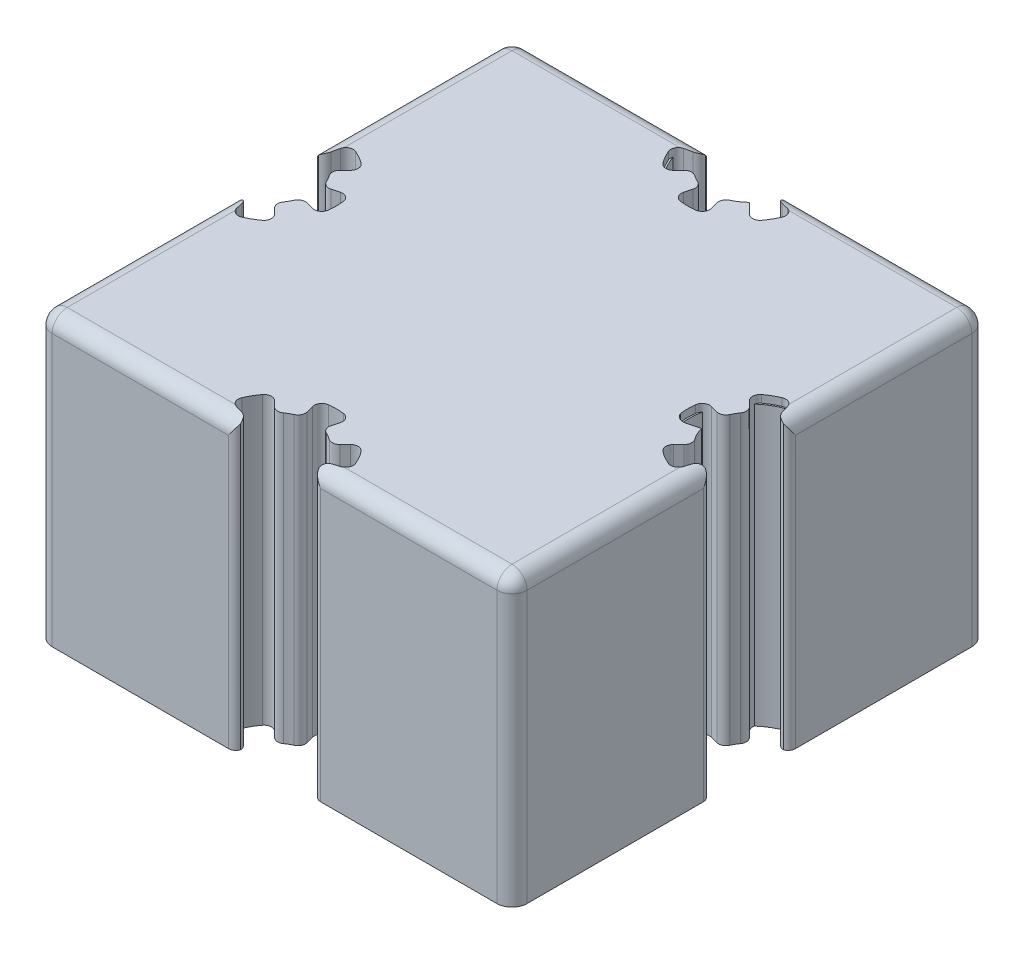
from build123d import *
from build123d.topology import SkipClean

# Parameters (mm, degrees)
SKETCH2_W            = 31.5
SKETCH2_H            = 31.5
BOSS_EXTRUDE1_DEPTH  = 19
CUT_EXTRUDE6_DEPTH   = 30.276697218
FILLET12_R           = 0.5
BOSS_EXTRUDE9_START  = -0.5
BOSS_EXTRUDE9_DEPTH  = 18.5
BOSS_EXTRUDE10_DEPTH = 19
CUT_EXTRUDE10_DEPTH  = 30.276697218
SKETCH15_W           = 0.6
SKETCH15_H           = 1.65
CUT_EXTRUDE13_DEPTH  = 1.5
CUT_EXTRUDE14_DEPTH  = 1.5
CUT_EXTRUDE15_START  = -17
CUT_EXTRUDE15_DEPTH  = 17
FILLET22_R           = 0.5
FILLET24_R           = 0.2
FILLET27_R           = 1
FILLET28_R           = 0.5


# Read off the part's stored shape, not the designer's step: Cut-Extrude15
with BuildPart() as part:
    # Sketch2 → Boss-Extrude1 (new body)
    with BuildSketch(Plane(origin=(0, 0, 0), x_dir=(1, 0, 0), z_dir=(0, 1, 0))):
        Rectangle(SKETCH2_W, SKETCH2_H)
    extrude(amount=BOSS_EXTRUDE1_DEPTH)

    # Sketch5 → Cut-Extrude6 (cut, through all)
    with BuildSketch(Plane(origin=(0, 19, 0), x_dir=(1, 0, 0), z_dir=(0, 1, 0))):
        with BuildLine():
            Line((-2.899137803, 12.850862197), (-1.838477631, 13.911522369))
            ThreePointArc((-1.838477631, 13.911522369), (-2.25166605, 14.45), (-2.511407148, 15.077070483))
            Line((-2.511407148, 15.077070483), (-3.960295888, 14.688841915))
            ThreePointArc((-3.960295888, 14.688841915), (-3.550704156, 13.7), (-2.899137803, 12.850862197))
        make_face()
        with BuildLine():
            Line((1.061158085, 11.789704112), (0.672929517, 13.238592852))
            ThreePointArc((0.672929517, 13.238592852), (0, 13.15), (-0.672929517, 13.238592852))
            Line((-0.672929517, 13.238592852), (-1.061158085, 11.789704112))
            ThreePointArc((-1.061158085, 11.789704112), (0, 11.65), (1.061158085, 11.789704112))
        make_face()
        with BuildLine():
            ThreePointArc((2.511407148, 15.077070483), (2.25166605, 14.45), (1.838477631, 13.911522369))
            Line((1.838477631, 13.911522369), (2.899137803, 12.850862197))
            ThreePointArc((2.899137803, 12.850862197), (3.550704156, 13.7), (3.960295888, 14.688841915))
            Line((3.960295888, 14.688841915), (2.511407148, 15.077070483))
        make_face()
        with BuildLine():
            ThreePointArc((-0.672929517, 13.238592852), (0, 13.15), (0.672929517, 13.238592852))
            ThreePointArc((0.672929517, 13.238592852), (1.3, 13.49833395), (1.838477631, 13.911522369))
            ThreePointArc((1.838477631, 13.911522369), (2.25166605, 14.45), (2.511407148, 15.077070483))
            ThreePointArc((2.511407148, 15.077070483), (2.57775664, 15.4106319), (2.6, 15.75))
            Line((2.6, 15.75), (0, 15.75))
            Line((0, 15.75), (-2.6, 15.75))
            ThreePointArc((-2.6, 15.75), (-2.57775664, 15.4106319), (-2.511407148, 15.077070483))
            ThreePointArc((-2.511407148, 15.077070483), (-2.25166605, 14.45), (-1.838477631, 13.911522369))
            ThreePointArc((-1.838477631, 13.911522369), (-1.3, 13.49833395), (-0.672929517, 13.238592852))
        make_face()
        with BuildLine():
            Line((15.75, -2.6), (15.75, 0))
            Line((15.75, 0), (15.75, 2.6))
            ThreePointArc((15.75, 2.6), (15.4106319, 2.57775664), (15.077070483, 2.511407148))
            ThreePointArc((15.077070483, 2.511407148), (14.45, 2.25166605), (13.911522369, 1.838477631))
            ThreePointArc((13.911522369, 1.838477631), (13.49833395, 1.3), (13.238592852, 0.672929517))
            ThreePointArc((13.238592852, 0.672929517), (13.15, 0), (13.238592852, -0.672929517))
            ThreePointArc((13.238592852, -0.672929517), (13.49833395, -1.3), (13.911522369, -1.838477631))
            ThreePointArc((13.911522369, -1.838477631), (14.45, -2.25166605), (15.077070483, -2.511407148))
            ThreePointArc((15.077070483, -2.511407148), (15.4106319, -2.57775664), (15.75, -2.6))
        make_face()
        with BuildLine():
            ThreePointArc((13.911522369, 1.838477631), (14.45, 2.25166605), (15.077070483, 2.511407148))
            Line((15.077070483, 2.511407148), (14.688841915, 3.960295888))
            ThreePointArc((14.688841915, 3.960295888), (13.7, 3.550704156), (12.850862197, 2.899137803))
            Line((12.850862197, 2.899137803), (13.911522369, 1.838477631))
        make_face()
        with BuildLine():
            Line((11.789704112, -1.061158085), (13.238592852, -0.672929517))
            ThreePointArc((13.238592852, -0.672929517), (13.15, 0), (13.238592852, 0.672929517))
            Line((13.238592852, 0.672929517), (11.789704112, 1.061158085))
            ThreePointArc((11.789704112, 1.061158085), (11.65, 0), (11.789704112, -1.061158085))
        make_face()
        with BuildLine():
            Line((14.688841915, -3.960295888), (15.077070483, -2.511407148))
            ThreePointArc((15.077070483, -2.511407148), (14.45, -2.25166605), (13.911522369, -1.838477631))
            Line((13.911522369, -1.838477631), (12.850862197, -2.899137803))
            ThreePointArc((12.850862197, -2.899137803), (13.7, -3.550704156), (14.688841915, -3.960295888))
        make_face()
    extrude(amount=-CUT_EXTRUDE6_DEPTH, mode=Mode.SUBTRACT)

    # Fillet12
    fillet12_edges = [part.edges().sort_by_distance(p)[0] for p in [
        (-2.899137803, 9.5, -12.850862197),
        (-3.960295888, 9.5, -14.688841915),
        (3.960295888, 9.5, -14.688841915),
        (2.899137803, 9.5, -12.850862197),
        (1.061158085, 9.5, -11.789704112),
        (-1.061158085, 9.5, -11.789704112),
        (14.688841915, 9.5, 3.960295888),
        (12.850862197, 9.5, 2.899137803),
        (11.789704112, 9.5, 1.061158085),
        (11.789704112, 9.5, -1.061158085),
        (12.850862197, 9.5, -2.899137803),
        (14.688841915, 9.5, -3.960295888),
    ]]
    fillet(fillet12_edges, radius=FILLET12_R)

    # Sketch10 → Boss-Extrude9 (add, through all)
    with BuildSketch(Plane(origin=(0, 19, 0), x_dir=(1, 0, 0), z_dir=(0, 1, 0)).offset(BOSS_EXTRUDE9_START)):
        with BuildLine():
            Line((15.75, 4.4), (15.75, 4))
            ThreePointArc((15.75, 4), (11.75, 0), (15.75, -4))
            Line((15.75, -4), (15.75, -4.4))
            ThreePointArc((15.75, -4.4), (11.35, 0), (15.75, 4.4))
        make_face()
        with BuildLine():
            Line((-4.4, 15.75), (-4, 15.75))
            ThreePointArc((-4, 15.75), (0, 11.75), (4, 15.75))
            Line((4, 15.75), (4.4, 15.75))
            ThreePointArc((4.4, 15.75), (0, 11.35), (-4.4, 15.75))
        make_face()
    extrude(amount=-BOSS_EXTRUDE9_DEPTH)

    # Sketch11 → Boss-Extrude10 (add, through all)
    with BuildSketch(Plane(origin=(0, 19, 0), x_dir=(1, 0, 0), z_dir=(0, 1, 0))):
        with BuildLine():
            Line((12.306369439, -0.922718028), (13.238592852, -0.672929517))
            Line((13.238592852, -0.672929517), (12.399440494, -0.88753005))
            ThreePointArc((12.399440494, -0.88753005), (11.964637448, -0.834388388), (11.680704349, -0.500832214))
            ThreePointArc((11.680704349, -0.500832214), (11.897422951, -0.854314019), (12.306369439, -0.922718028))
        make_face()
    extrude(amount=-BOSS_EXTRUDE10_DEPTH)

    # Sketch6 → Cut-Extrude10 (cut, through all)
    with BuildSketch(Plane(origin=(0, 19, 0), x_dir=(1, 0, 0), z_dir=(0, 1, 0))):
        with BuildLine():
            Line((-2.6, -15.75), (2.6, -15.75))
            ThreePointArc((2.6, -15.75), (2.57775664, -15.4106319), (2.511407148, -15.077070483))
            Line((2.511407148, -15.077070483), (3.960295888, -14.688841915))
            ThreePointArc((3.960295888, -14.688841915), (3.550704156, -13.7), (2.899137803, -12.850862197))
            Line((2.899137803, -12.850862197), (1.838477631, -13.911522369))
            ThreePointArc((1.838477631, -13.911522369), (1.3, -13.49833395), (0.672929517, -13.238592852))
            Line((0.672929517, -13.238592852), (1.061158085, -11.789704112))
            ThreePointArc((1.061158085, -11.789704112), (0, -11.65), (-1.061158085, -11.789704112))
            Line((-1.061158085, -11.789704112), (-0.672929517, -13.238592852))
            ThreePointArc((-0.672929517, -13.238592852), (-1.3, -13.49833395), (-1.838477631, -13.911522369))
            Line((-1.838477631, -13.911522369), (-2.899137803, -12.850862197))
            ThreePointArc((-2.899137803, -12.850862197), (-3.550704156, -13.7), (-3.960295888, -14.688841915))
            Line((-3.960295888, -14.688841915), (-2.511407148, -15.077070483))
            ThreePointArc((-2.511407148, -15.077070483), (-2.57775664, -15.4106319), (-2.6, -15.75))
        make_face()
        with BuildLine():
            Line((-15.75, 2.6), (-15.75, -2.6))
            ThreePointArc((-15.75, -2.6), (-15.4106319, -2.57775664), (-15.077070483, -2.511407148))
            Line((-15.077070483, -2.511407148), (-14.688841915, -3.960295888))
            ThreePointArc((-14.688841915, -3.960295888), (-13.7, -3.550704156), (-12.850862197, -2.899137803))
            Line((-12.850862197, -2.899137803), (-13.911522369, -1.838477631))
            ThreePointArc((-13.911522369, -1.838477631), (-13.49833395, -1.3), (-13.238592852, -0.672929517))
            Line((-13.238592852, -0.672929517), (-11.789704112, -1.061158085))
            ThreePointArc((-11.789704112, -1.061158085), (-11.65, 0), (-11.789704112, 1.061158085))
            Line((-11.789704112, 1.061158085), (-13.238592852, 0.672929517))
            ThreePointArc((-13.238592852, 0.672929517), (-13.49833395, 1.3), (-13.911522369, 1.838477631))
            Line((-13.911522369, 1.838477631), (-12.850862197, 2.899137803))
            ThreePointArc((-12.850862197, 2.899137803), (-13.7, 3.550704156), (-14.688841915, 3.960295888))
            Line((-14.688841915, 3.960295888), (-15.077070483, 2.511407148))
            ThreePointArc((-15.077070483, 2.511407148), (-15.4106319, 2.57775664), (-15.75, 2.6))
        make_face()
    extrude(amount=-CUT_EXTRUDE10_DEPTH, mode=Mode.SUBTRACT)

    # Sketch15 → Cut-Extrude13 (cut)
    with BuildSketch(Plane.XZ):
        with Locations((7.476057473, -13.220362663)):
            Rectangle(SKETCH15_W, SKETCH15_H)
        with BuildLine():
            Line((-0.472700067, 4.977605312), (-0.549642862, 10.981573349))
            ThreePointArc((-0.549642862, 10.981573349), (-2.947700228, 11.961720263), (-4.487116173, 14.045362663))
            Line((-4.487116173, 14.045362663), (-7.176057473, 14.045362663))
            Line((-7.176057473, 14.045362663), (-7.176057473, 12.395362663))
            Line((-7.176057473, 12.395362663), (-7.776057473, 12.395362663))
            Line((-7.776057473, 12.395362663), (-7.776057473, 14.045362663))
            Line((-7.776057473, 14.045362663), (-14.35, 14.045362663))
            Line((-14.35, 14.045362663), (-14.35, 7.35))
            Line((-14.35, 7.35), (-12.7, 7.35))
            Line((-12.7, 7.35), (-12.7, 6.75))
            Line((-12.7, 6.75), (-14.35, 6.75))
            Line((-14.35, 6.75), (-14.35, 4.591296113))
            ThreePointArc((-14.35, 4.591296113), (-12.046772072, 3.053866879), (-10.976112695, 0.5))
            Line((-10.976112695, 0.5), (-4.974937186, 0.5))
            ThreePointArc((-4.974937186, 0.5), (-4.666144763, 1.796411158), (-4.025862949, 2.965202778))
            Line((-4.025862949, 2.965202778), (-4.980457104, 3.919796932))
            Line((-4.980457104, 3.919796932), (-3.919796932, 4.980457104))
            Line((-3.919796932, 4.980457104), (-2.965202778, 4.025862949))
            ThreePointArc((-2.965202778, 4.025862949), (-1.783605162, 4.671054766), (-0.472700067, 4.977605312))
        make_face()
    extrude(amount=-CUT_EXTRUDE13_DEPTH, mode=Mode.SUBTRACT)

    # Sketch15<9> → Cut-Extrude14 (cut)
    # profile 1 of 10: a face of its own
    with BuildSketch(Plane.XZ):
        with BuildLine():
            ThreePointArc((0.5, 4.974937186), (0.534389665, 4.971360748), (0.568753777, 4.967546592))
            Line((0.568753777, 4.967546592), (0.551724138, 10.981813712))
            ThreePointArc((0.551724138, 10.981813712), (0.001048276, 10.946696158), (-0.549642862, 10.981573349))
            Line((-0.549642862, 10.981573349), (-0.472700067, 4.977605312))
            ThreePointArc((-0.472700067, 4.977605312), (0.013780983, 5.024034974), (0.5, 4.974937186))
        make_face()
    # profile 2 of 10: a face of its own
    with BuildSketch(Plane.XZ):
        with BuildLine():
            ThreePointArc((10.9766874, 0.505457043), (10.950020476, -0.014020469), (10.979721648, -0.533333333))
            Line((10.979721648, -0.533333333), (4.974937186, -0.5))
            ThreePointArc((4.974937186, -0.5), (5.02485022, -0.005824144), (4.976082885, 0.48846609))
            Line((4.976082885, 0.48846609), (10.9766874, 0.505457043))
        make_face()
    # profile 3 of 10: a face of its own
    with BuildSketch(Plane.XZ):
        with BuildLine():
            Line((-10.976112695, -0.5), (-4.974937186, -0.5))
            ThreePointArc((-4.974937186, -0.5), (-5.025447443, 0), (-4.974937186, 0.5))
            Line((-4.974937186, 0.5), (-10.976112695, 0.5))
            ThreePointArc((-10.976112695, 0.5), (-10.95, 0), (-10.976112695, -0.5))
        make_face()
    # profile 4 of 10: a face of its own
    with BuildSketch(Plane.XZ):
        with BuildLine():
            Line((-0.472700067, -4.977605312), (-0.521600074, -10.978424436))
            ThreePointArc((-0.521600074, -10.978424436), (0.000318742, -10.947035565), (0.522233389, -10.978493709))
            Line((0.522233389, -10.978493709), (0.483783489, -4.976540318))
            ThreePointArc((0.483783489, -4.976540318), (0.005593118, -5.023242206), (-0.472700067, -4.977605312))
        make_face()
    # profile 5 of 10: a face of its own
    with BuildSketch(Plane.XZ):
        with BuildLine():
            ThreePointArc((-2.965202778, -4.025862949), (-1.783605162, -4.671054766), (-0.472700067, -4.977605312))
            ThreePointArc((-0.472700067, -4.977605312), (0.005593118, -5.023242206), (0.483783489, -4.976540318))
            ThreePointArc((0.483783489, -4.976540318), (1.788805029, -4.66906592), (2.965202778, -4.025862949))
            Line((2.965202778, -4.025862949), (3.919796932, -4.980457104))
            Line((3.919796932, -4.980457104), (4.980457104, -3.919796932))
            Line((4.980457104, -3.919796932), (4.025862949, -2.965202778))
            ThreePointArc((4.025862949, -2.965202778), (4.666144763, -1.796411158), (4.974937186, -0.5))
            ThreePointArc((4.974937186, -0.5), (5.02485022, -0.005824144), (4.976082885, 0.48846609))
            ThreePointArc((4.976082885, 0.48846609), (4.66822379, 1.791001575), (4.025862949, 2.965202778))
            Line((4.025862949, 2.965202778), (4.980457104, 3.919796932))
            Line((4.980457104, 3.919796932), (4.450127018, 4.450127018))
            Line((4.450127018, 4.450127018), (3.919796932, 4.980457104))
            Line((3.919796932, 4.980457104), (2.965202778, 4.025862949))
            ThreePointArc((2.965202778, 4.025862949), (1.796411158, 4.666144763), (0.5, 4.974937186))
            ThreePointArc((0.5, 4.974937186), (0.013780983, 5.024034974), (-0.472700067, 4.977605312))
            ThreePointArc((-0.472700067, 4.977605312), (-1.783605162, 4.671054766), (-2.965202778, 4.025862949))
            Line((-2.965202778, 4.025862949), (-3.919796932, 4.980457104))
            Line((-3.919796932, 4.980457104), (-4.450127018, 4.450127018))
            Line((-4.450127018, 4.450127018), (-4.980457104, 3.919796932))
            Line((-4.980457104, 3.919796932), (-4.025862949, 2.965202778))
            ThreePointArc((-4.025862949, 2.965202778), (-4.666144763, 1.796411158), (-4.974937186, 0.5))
            ThreePointArc((-4.974937186, 0.5), (-5.025447443, 0), (-4.974937186, -0.5))
            ThreePointArc((-4.974937186, -0.5), (-4.666144763, -1.796411158), (-4.025862949, -2.965202778))
            Line((-4.025862949, -2.965202778), (-4.980457104, -3.919796932))
            Line((-4.980457104, -3.919796932), (-3.919796932, -4.980457104))
            Line((-3.919796932, -4.980457104), (-2.965202778, -4.025862949))
        make_face()
        with BuildLine():
            ThreePointArc((-2.414814566, -0.647047613), (-2.165063509, -1.25), (-1.767766953, -1.767766953))
            Line((-1.767766953, -1.767766953), (-2.828427125, -2.828427125))
            ThreePointArc((-2.828427125, -2.828427125), (3.464101615, 2), (-3.863703305, -1.03527618))
            Line((-3.863703305, -1.03527618), (-2.414814566, -0.647047613))
        make_face(mode=Mode.SUBTRACT)
    # profile 6 of 10: a face of its own
    with BuildSketch(Plane.XZ):
        with BuildLine():
            ThreePointArc((-1.03527618, -3.863703305), (0, -4), (1.03527618, -3.863703305))
            Line((1.03527618, -3.863703305), (0.647047613, -2.414814566))
            ThreePointArc((0.647047613, -2.414814566), (0, -2.5), (-0.647047613, -2.414814566))
            Line((-0.647047613, -2.414814566), (-1.03527618, -3.863703305))
        make_face()
    # profile 7 of 10: a face of its own
    with BuildSketch(Plane.XZ):
        with BuildLine():
            ThreePointArc((2.828427125, -2.828427125), (3.464101615, -2), (3.863703305, -1.03527618))
            Line((3.863703305, -1.03527618), (2.414814566, -0.647047613))
            ThreePointArc((2.414814566, -0.647047613), (2.165063509, -1.25), (1.767766953, -1.767766953))
            Line((1.767766953, -1.767766953), (2.828427125, -2.828427125))
        make_face()
    # profile 8 of 10: a face of its own
    with BuildSketch(Plane.XZ):
        with BuildLine():
            Line((2.828427125, 2.828427125), (1.767766953, 1.767766953))
            ThreePointArc((1.767766953, 1.767766953), (2.165063509, 1.25), (2.414814566, 0.647047613))
            Line((2.414814566, 0.647047613), (3.863703305, 1.03527618))
            ThreePointArc((3.863703305, 1.03527618), (3.464101615, 2), (2.828427125, 2.828427125))
        make_face()
    # profile 9 of 10: a face of its own
    with BuildSketch(Plane.XZ):
        with BuildLine():
            Line((0.647047613, 2.414814566), (1.03527618, 3.863703305))
            ThreePointArc((1.03527618, 3.863703305), (0, 4), (-1.03527618, 3.863703305))
            Line((-1.03527618, 3.863703305), (-0.647047613, 2.414814566))
            ThreePointArc((-0.647047613, 2.414814566), (0, 2.5), (0.647047613, 2.414814566))
        make_face()
    # profile 10 of 10: a face of its own
    with BuildSketch(Plane.XZ):
        with BuildLine():
            Line((-1.767766953, 1.767766953), (-2.828427125, 2.828427125))
            ThreePointArc((-2.828427125, 2.828427125), (-3.464101615, 2), (-3.863703305, 1.03527618))
            Line((-3.863703305, 1.03527618), (-2.414814566, 0.647047613))
            ThreePointArc((-2.414814566, 0.647047613), (-2.165063509, 1.25), (-1.767766953, 1.767766953))
        make_face()
    extrude(amount=-CUT_EXTRUDE14_DEPTH, mode=Mode.SUBTRACT)

    # Cut-Extrude15 outline → Cut-Extrude15 (cut)
    with SkipClean():  # the faces are left unmerged after this step: merging them gives an invalid solid
        with BuildSketch(Plane.XZ.offset(CUT_EXTRUDE15_START)):
            with BuildLine():
                ThreePointArc((-14.35, 4.591296113), (-12.046772072, 3.053866879), (-10.976112695, 0.5))
                Line((-10.976112695, 0.5), (-4.974937186, 0.5))
                ThreePointArc((-4.974937186, 0.5), (-4.666144763, 1.796411158), (-4.025862949, 2.965202778))
                Line((-4.025862949, 2.965202778), (-4.980457104, 3.919796932))
                Line((-4.980457104, 3.919796932), (-3.919796932, 4.980457104))
                Line((-3.919796932, 4.980457104), (-2.965202778, 4.025862949))
                ThreePointArc((-2.965202778, 4.025862949), (-1.783605162, 4.671054766), (-0.472700067, 4.977605312))
                Line((-0.472700067, 4.977605312), (-0.549642862, 10.981573349))
                ThreePointArc((-0.549642862, 10.981573349), (-2.947700228, 11.961720263), (-4.487116173, 14.045362663))
                Line((-4.487116173, 14.045362663), (-7.176057473, 14.045362663))
                Line((-7.176057473, 14.045362663), (-7.176057473, 12.395362663))
                Line((-7.176057473, 12.395362663), (-7.776057473, 12.395362663))
                Line((-7.776057473, 12.395362663), (-7.776057473, 14.045362663))
                Line((-7.776057473, 14.045362663), (-14.35, 14.045362663))
                Line((-14.35, 14.045362663), (-14.35, 7.35))
                Line((-14.35, 7.35), (-12.7, 7.35))
                Line((-12.7, 7.35), (-12.7, 6.75))
                Line((-12.7, 6.75), (-14.35, 6.75))
                Line((-14.35, 6.75), (-14.35, 4.591296113))
            make_face()
            with BuildLine():
                ThreePointArc((-10.976112695, -0.5), (-12.046772072, -3.053866879), (-14.35, -4.591296113))
                Line((-14.35, -4.591296113), (-14.35, -6.75))
                Line((-14.35, -6.75), (-12.7, -6.75))
                Line((-12.7, -6.75), (-12.7, -7.35))
                Line((-12.7, -7.35), (-14.35, -7.35))
                Line((-14.35, -7.35), (-14.35, -14.045362663))
                Line((-14.35, -14.045362663), (-7.776057473, -14.045362663))
                Line((-7.776057473, -14.045362663), (-7.776057473, -12.395362663))
                Line((-7.776057473, -12.395362663), (-7.176057473, -12.395362663))
                Line((-7.176057473, -12.395362663), (-7.176057473, -14.045362663))
                Line((-7.176057473, -14.045362663), (-4.487116173, -14.045362663))
                ThreePointArc((-4.487116173, -14.045362663), (-2.936551912, -11.953071917), (-0.521600074, -10.978424436))
                Line((-0.521600074, -10.978424436), (-0.472700067, -4.977605312))
                ThreePointArc((-0.472700067, -4.977605312), (-1.783605162, -4.671054766), (-2.965202778, -4.025862949))
                Line((-2.965202778, -4.025862949), (-3.919796932, -4.980457104))
                Line((-3.919796932, -4.980457104), (-4.980457104, -3.919796932))
                Line((-4.980457104, -3.919796932), (-4.025862949, -2.965202778))
                ThreePointArc((-4.025862949, -2.965202778), (-4.666144763, -1.796411158), (-4.974937186, -0.5))
                Line((-4.974937186, -0.5), (-10.976112695, -0.5))
            make_face()
            with BuildLine():
                ThreePointArc((14.35, -4.591296113), (12.05746033, -3.066781828), (10.979721648, -0.533333333))
                Line((10.979721648, -0.533333333), (4.974937186, -0.5))
                ThreePointArc((4.974937186, -0.5), (4.666144763, -1.796411158), (4.025862949, -2.965202778))
                Line((4.025862949, -2.965202778), (4.980457104, -3.919796932))
                Line((4.980457104, -3.919796932), (3.919796932, -4.980457104))
                Line((3.919796932, -4.980457104), (2.965202778, -4.025862949))
                ThreePointArc((2.965202778, -4.025862949), (1.788805029, -4.66906592), (0.483783489, -4.976540318))
                Line((0.483783489, -4.976540318), (0.522233389, -10.978493709))
                ThreePointArc((0.522233389, -10.978493709), (2.936803884, -11.953266806), (4.487116173, -14.045362663))
                Line((4.487116173, -14.045362663), (7.176057473, -14.045362663))
                Line((7.176057473, -14.045362663), (7.176057473, -12.395362663))
                Line((7.176057473, -12.395362663), (7.776057473, -12.395362663))
                Line((7.776057473, -12.395362663), (7.776057473, -14.045362663))
                Line((7.776057473, -14.045362663), (14.35, -14.045362663))
                Line((14.35, -14.045362663), (14.35, -7.35))
                Line((14.35, -7.35), (12.7, -7.35))
                Line((12.7, -7.35), (12.7, -6.75))
                Line((12.7, -6.75), (14.35, -6.75))
                Line((14.35, -6.75), (14.35, -4.591296113))
            make_face()
            with BuildLine():
                Line((14.35, 6.75), (12.7, 6.75))
                Line((12.7, 6.75), (12.7, 7.35))
                Line((12.7, 7.35), (14.35, 7.35))
                Line((14.35, 7.35), (14.35, 14.045362663))
                Line((14.35, 14.045362663), (7.776057473, 14.045362663))
                Line((7.776057473, 14.045362663), (7.776057473, 12.395362663))
                Line((7.776057473, 12.395362663), (7.176057473, 12.395362663))
                Line((7.176057473, 12.395362663), (7.176057473, 14.045362663))
                Line((7.176057473, 14.045362663), (4.487116173, 14.045362663))
                ThreePointArc((4.487116173, 14.045362663), (2.948526914, 11.962363661), (0.551724138, 10.981813712))
                Line((0.551724138, 10.981813712), (0.568753777, 4.967546592))
                ThreePointArc((0.568753777, 4.967546592), (1.828634533, 4.653611044), (2.965202778, 4.025862949))
                Line((2.965202778, 4.025862949), (3.919796932, 4.980457104))
                Line((3.919796932, 4.980457104), (4.980457104, 3.919796932))
                Line((4.980457104, 3.919796932), (4.025862949, 2.965202778))
                ThreePointArc((4.025862949, 2.965202778), (4.66822379, 1.791001576), (4.976082885, 0.48846609))
                Line((4.976082885, 0.48846609), (10.9766874, 0.505457043))
                ThreePointArc((10.9766874, 0.505457043), (12.048518224, 3.055983092), (14.35, 4.591296113))
                Line((14.35, 4.591296113), (14.35, 6.75))
            make_face()
            with BuildLine():
                Line((2.828427125, -2.828427125), (1.767766953, -1.767766953))
                ThreePointArc((1.767766953, -1.767766953), (2.165063509, -1.25), (2.414814566, -0.647047613))
                Line((2.414814566, -0.647047613), (3.863703305, -1.03527618))
                ThreePointArc((3.863703305, -1.03527618), (4, 0), (3.863703305, 1.03527618))
                Line((3.863703305, 1.03527618), (2.414814566, 0.647047613))
                ThreePointArc((2.414814566, 0.647047613), (2.165063509, 1.25), (1.767766953, 1.767766953))
                Line((1.767766953, 1.767766953), (2.828427125, 2.828427125))
                ThreePointArc((2.828427125, 2.828427125), (2, 3.464101615), (1.03527618, 3.863703305))
                Line((1.03527618, 3.863703305), (0.647047613, 2.414814566))
                ThreePointArc((0.647047613, 2.414814566), (0, 2.5), (-0.647047613, 2.414814566))
                Line((-0.647047613, 2.414814566), (-1.03527618, 3.863703305))
                ThreePointArc((-1.03527618, 3.863703305), (-2, 3.464101615), (-2.828427125, 2.828427125))
                Line((-2.828427125, 2.828427125), (-1.767766953, 1.767766953))
                ThreePointArc((-1.767766953, 1.767766953), (-2.165063509, 1.25), (-2.414814566, 0.647047613))
                Line((-2.414814566, 0.647047613), (-3.863703305, 1.03527618))
                ThreePointArc((-3.863703305, 1.03527618), (-4, 0), (-3.863703305, -1.03527618))
                Line((-3.863703305, -1.03527618), (-2.414814566, -0.647047613))
                ThreePointArc((-2.414814566, -0.647047613), (-2.165063509, -1.25), (-1.767766953, -1.767766953))
                Line((-1.767766953, -1.767766953), (-2.828427125, -2.828427125))
                ThreePointArc((-2.828427125, -2.828427125), (-2, -3.464101615), (-1.03527618, -3.863703305))
                Line((-1.03527618, -3.863703305), (-0.647047613, -2.414814566))
                ThreePointArc((-0.647047613, -2.414814566), (0, -2.5), (0.647047613, -2.414814566))
                Line((0.647047613, -2.414814566), (1.03527618, -3.863703305))
                ThreePointArc((1.03527618, -3.863703305), (2, -3.464101615), (2.828427125, -2.828427125))
            make_face()
        extrude(amount=CUT_EXTRUDE15_DEPTH, mode=Mode.SUBTRACT)

    # Fillet22
    # the kernel refuses this fillet: 0.5 mm, written as the material it adds along each edge
    with BuildSketch(Plane(origin=(2.899137803, 19, 12.850862197), x_dir=(0.6561673228343695, 0, 0.7546154281780728), z_dir=(0, -1, 0)), Plane(origin=(-3.960295888, 19, 14.688841915), x_dir=(0.32543246947275295, 0, -0.9455652847968063), z_dir=(0, -1, 0)), Plane(origin=(-1.061158085, 19, 11.789704112), x_dir=(0.9815997923070684, 0, -0.1909498566187469), z_dir=(0, -1, 0)), Plane(origin=(-12.850862197, 19, 2.899137803), x_dir=(-0.7546154281781163, 0, 0.6561673228343196), z_dir=(0, -1, 0)), Plane(origin=(-14.688841915, 19, -3.960295888), x_dir=(0.9455652847968052, 0, 0.3254324694727565), z_dir=(0, -1, 0)), Plane(origin=(-11.789704112, 19, -1.061158085), x_dir=(0.19094985661869154, 0, 0.9815997923070793), z_dir=(0, -1, 0))) as fillet22_piece_1:
        with BuildLine():
            CenterArc((0.536022586, 0.498787025), FILLET22_R, 176.008221927, 97.983556146)
            Line((0.037235561, 0.533593686), (0, 0))
            ThreePointArc((0, 0), (0.285414624, -0.009946395), (0.570829248, 0))
        make_face()
    extrude(amount=19)
    with BuildSketch(Plane(origin=(3.960295888, 19, 14.688841915), x_dir=(-0.9659258262890663, 0, 0.25881904510252796), z_dir=(0, -1, 0)), Plane(origin=(-2.899137803, 19, 12.850862197), x_dir=(0.707106781186548, 0, 0.7071067811865471), z_dir=(0, -1, 0)), Plane(origin=(1.061158085, 19, 11.789704112), x_dir=(-0.25881904510251674, 0, 0.9659258262890694), z_dir=(0, -1, 0)), Plane(origin=(-14.688841915, 19, 3.960295888), x_dir=(-0.2588190451025208, 0, -0.9659258262890682), z_dir=(0, -1, 0)), Plane(origin=(-12.850862197, 19, -2.899137803), x_dir=(-0.707106781186543, 0, 0.7071067811865521), z_dir=(0, -1, 0)), Plane(origin=(-11.789704112, 19, 1.061158085), x_dir=(-0.9659258262890695, 0, -0.2588190451025163), z_dir=(0, -1, 0))) as fillet22_piece_2:
        with BuildLine():
            CenterArc((0.534891306, 0.5), FILLET22_R, 172.016443854, 97.983556146)
            ThreePointArc((0.039737321, 0.569444444), (0.009946395, 0.285414624), (0, 0))
            Line((0, 0), (0.534891306, 0))
        make_face()
    extrude(amount=19)
    # the kernel refuses this fillet: 0.5 mm, written as the material it takes off along each edge
    with BuildSketch(Plane(origin=(1.838477631, 20.14852927, 13.911522369), x_dir=(0.707106781186548, 0, -0.7071067811865471), z_dir=(0, -1, 0)), Plane(origin=(2.6, 20.14852927, 15.75), x_dir=(1, 0, 0), z_dir=(0, -1, 0)), Plane(origin=(-2.511407148, 20.14852927, 15.077070483), x_dir=(-0.965925826289072, 0, -0.2588190451025071), z_dir=(0, -1, 0)), Plane(origin=(-0.672929517, 20.14852927, 13.238592852), x_dir=(-0.2588190451025268, 0, -0.9659258262890666), z_dir=(0, -1, 0)), Plane(origin=(-13.911522369, 20.14852927, 1.838477631), x_dir=(0.707106781186548, 0, 0.7071067811865471), z_dir=(0, -1, 0)), Plane(origin=(-15.75, 20.14852927, 2.6), x_dir=(0, 0, 1), z_dir=(0, -1, 0)), Plane(origin=(-15.077070483, 20.14852927, -2.511407148), x_dir=(0.25881904510251474, 0, -0.9659258262890699), z_dir=(0, -1, 0)), Plane(origin=(-13.238592852, 20.14852927, -0.672929517), x_dir=(0.9659258262890666, 0, -0.2588190451025267), z_dir=(0, -1, 0)), Plane(origin=(-2.6, 20.14852927, -15.75), x_dir=(-1, 0, 0), z_dir=(0, -1, 0)), Plane(origin=(15.077070483, 20.14852927, 2.511407148), x_dir=(-0.258819045102521, 0, 0.9659258262890682), z_dir=(0, -1, 0))) as fillet22_2_piece_1:
        with BuildLine():
            CenterArc((0.459411708, -0.5), FILLET22_R, 90, 80.718200913)
            ThreePointArc((-0.034041793, -0.419354839), (-0.008524422, -0.210367134), (0, 0))
            Line((0, 0), (0.459411708, 0))
        make_face()
    extrude(amount=21.297058541, mode=Mode.SUBTRACT)
    with BuildSketch(Plane(origin=(2.511407148, 20.14852927, 15.077070483), x_dir=(0.17981699482895722, 0, 0.9837000804974465), z_dir=(0, -1, 0)), Plane(origin=(-2.6, 20.14852927, 15.75), x_dir=(0.08091043619070253, 0, -0.9967213759699499), z_dir=(0, -1, 0)), Plane(origin=(-1.838477631, 20.14852927, 13.911522369), x_dir=(0.7620007620011424, 0, -0.6475761258027337), z_dir=(0, -1, 0)), Plane(origin=(0.672929517, 20.14852927, 13.238592852), x_dir=(0.9418177568300777, 0, 0.33612395469463446), z_dir=(0, -1, 0)), Plane(origin=(-15.077070483, 20.14852927, 2.511407148), x_dir=(-0.983700080497456, 0, 0.17981699482890498), z_dir=(0, -1, 0)), Plane(origin=(-15.75, 20.14852927, -2.6), x_dir=(0.99672137596995, 0, 0.08091043619070043), z_dir=(0, -1, 0)), Plane(origin=(-13.911522369, 20.14852927, -1.838477631), x_dir=(0.6475761258027405, 0, 0.762000762001137), z_dir=(0, -1, 0)), Plane(origin=(-13.238592852, 20.14852927, 0.672929517), x_dir=(-0.33612395469471673, 0, 0.9418177568300484), z_dir=(0, -1, 0)), Plane(origin=(-2.511407148, 20.14852927, -15.077070483), x_dir=(-0.17981699482889654, 0, -0.9837000804974576), z_dir=(0, -1, 0)), Plane(origin=(15.75, 20.14852927, 2.6), x_dir=(-0.9967213759699499, 0, -0.08091043619070253), z_dir=(0, -1, 0))) as fillet22_2_piece_2:
        with BuildLine():
            CenterArc((0.461189486, -0.498360688), FILLET22_R, 94.640899543, 80.718200913)
            Line((-0.037171202, -0.45790547), (0, 0))
            ThreePointArc((0, 0), (0.210367134, -0.008524422), (0.420734268, 0))
        make_face()
    extrude(amount=21.297058541, mode=Mode.SUBTRACT)
    with BuildSketch(Plane(origin=(-1.838477631, 20.14852927, -13.911522369), x_dir=(0.7620007620011381, 0, 0.6475761258027389), z_dir=(0, -1, 0)), Plane(origin=(2.511407148, 20.14852927, -15.077070483), x_dir=(0.17981699482890498, 0, -0.983700080497456), z_dir=(0, -1, 0)), Plane(origin=(0.672929517, 20.14852927, -13.238592852), x_dir=(0.9418177568300478, 0, -0.33612395469471856), z_dir=(0, -1, 0)), Plane(origin=(15.75, 20.14852927, -2.6), x_dir=(-0.996721375969959, 0, 0.0809104361905899), z_dir=(0, -1, 0)), Plane(origin=(13.911522369, 20.14852927, -1.838477631), x_dir=(-0.6475761258027356, 0, 0.762000762001141), z_dir=(0, -1, 0))) as fillet22_2_piece_3:
        with BuildLine():
            CenterArc((0.461189486, 0.498360688), FILLET22_R, 184.640899543, 80.718200913)
            Line((-0.037171202, 0.45790547), (0, 0))
            ThreePointArc((0, 0), (0.210367134, 0.008524422), (0.420734268, 0))
        make_face()
    extrude(amount=21.297058541, mode=Mode.SUBTRACT)
    with BuildSketch(Plane(origin=(2.6, 20.14852927, -15.75), x_dir=(1, 0, 0), z_dir=(0, -1, 0)), Plane(origin=(-0.672929517, 20.14852927, -13.238592852), x_dir=(-0.25881904510251863, 0, 0.9659258262890689), z_dir=(0, -1, 0)), Plane(origin=(13.911522369, 20.14852927, 1.838477631), x_dir=(-0.7071067811865468, 0, 0.7071067811865482), z_dir=(0, -1, 0)), Plane(origin=(13.238592852, 20.14852927, -0.672929517), x_dir=(-0.9659258262890704, 0, -0.2588190451025129), z_dir=(0, -1, 0)), Plane(origin=(15.077070483, 20.14852927, -2.511407148), x_dir=(-0.25881904510252224, 0, -0.965925826289068), z_dir=(0, -1, 0))) as fillet22_2_piece_4:
        with BuildLine():
            CenterArc((0.459411708, 0.5), FILLET22_R, 189.281799087, 80.718200913)
            ThreePointArc((-0.034041793, 0.419354839), (-0.008524422, 0.210367134), (0, 0))
            Line((0, 0), (0.459411708, 0))
        make_face()
    extrude(amount=21.297058541, mode=Mode.SUBTRACT)

    # Fillet24
    fillet24_edges = [part.edges().sort_by_distance(p)[0] for p in [
        (-12.7, 8.5, 6.75),
        (-12.7, 8.5, 7.35),
        (-7.776057473, 9.25, 12.395362663),
        (-7.176057473, 9.25, 12.395362663),
        (4.980457104, 9.25, 3.919796932),
        (3.919796932, 9.25, 4.980457104),
        (7.176057473, 8.5, 12.395362663),
        (7.776057473, 8.5, 12.395362663),
        (12.7, 8.5, 7.35),
        (12.7, 8.5, 6.75),
        (-4.980457104, 9.25, -3.919796932),
        (-3.919796932, 9.25, -4.980457104),
        (-7.176057473, 8.5, -12.395362663),
        (-7.776057473, 8.5, -12.395362663),
        (-12.7, 8.5, -7.35),
        (-12.7, 8.5, -6.75),
        (12.7, 8.5, -6.75),
        (12.7, 8.5, -7.35),
        (7.776057473, 9.25, -12.395362663),
        (7.176057473, 9.25, -12.395362663),
        (3.919796932, 9.25, -4.980457104),
        (4.980457104, 9.25, -3.919796932),
        (-3.919796932, 9.25, 4.980457104),
        (-4.980457104, 9.25, 3.919796932),
    ]]
    fillet(fillet24_edges, radius=FILLET24_R)

    # Fillet27
    # the kernel refuses this fillet: 1 mm, written as the material it takes off along each edge
    with BuildSketch(Plane(origin=(-14.75, 18, 14.75), x_dir=(0, 1, 0), z_dir=(-1, 0, 0))) as fillet27_piece_1_section:
        Polygon((0, 0), (FILLET27_R, 0), (FILLET27_R, -FILLET27_R), (0, -FILLET27_R), align=None)
    fillet27_piece_1 = extrude(amount=FILLET27_R, mode=Mode.PRIVATE)
    fillet27_piece_1 = fillet27_piece_1 - Plane(origin=(-14.75, 18, 14.75), x_dir=(0, -0.7071067811865475, -0.7071067811865475), z_dir=(-1, 0, 0)) * Sphere(FILLET27_R, mode=Mode.PRIVATE)
    add(fillet27_piece_1, mode=Mode.SUBTRACT)
    with BuildSketch(Plane(origin=(14.75, 18, 14.75), x_dir=(1, 0, 0), z_dir=(0, 1, 0))) as fillet27_piece_2_section:
        Polygon((0, 0), (FILLET27_R, 0), (FILLET27_R, -FILLET27_R), (0, -FILLET27_R), align=None)
    fillet27_piece_2 = extrude(amount=FILLET27_R, mode=Mode.PRIVATE)
    fillet27_piece_2 = fillet27_piece_2 - Plane(origin=(14.75, 18, 14.75), x_dir=(-0.7071067811865476, 0, -0.7071067811865475), z_dir=(0, 1, 0)) * Sphere(FILLET27_R, mode=Mode.PRIVATE)
    add(fillet27_piece_2, mode=Mode.SUBTRACT)
    with BuildSketch(Plane(origin=(-14.75, 18, -14.75), x_dir=(0, 0, -1), z_dir=(-1, 0, 0))) as fillet27_piece_3_section:
        Polygon((0, 0), (FILLET27_R, 0), (FILLET27_R, -FILLET27_R), (0, -FILLET27_R), align=None)
    fillet27_piece_3 = extrude(amount=FILLET27_R, mode=Mode.PRIVATE)
    fillet27_piece_3 = fillet27_piece_3 - Plane(origin=(-14.75, 18, -14.75), x_dir=(0, -0.7071067811865475, 0.7071067811865475), z_dir=(-1, 0, 0)) * Sphere(FILLET27_R, mode=Mode.PRIVATE)
    add(fillet27_piece_3, mode=Mode.SUBTRACT)
    with BuildSketch(Plane(origin=(14.75, 18, -14.75), x_dir=(0, 0, -1), z_dir=(0, 1, 0))) as fillet27_piece_4_section:
        Polygon((0, 0), (FILLET27_R, 0), (FILLET27_R, -FILLET27_R), (0, -FILLET27_R), align=None)
    fillet27_piece_4 = extrude(amount=FILLET27_R, mode=Mode.PRIVATE)
    fillet27_piece_4 = fillet27_piece_4 - Plane(origin=(14.75, 18, -14.75), x_dir=(-0.7071067811865475, 0, 0.7071067811865475), z_dir=(0, 1, 0)) * Sphere(FILLET27_R, mode=Mode.PRIVATE)
    add(fillet27_piece_4, mode=Mode.SUBTRACT)
    with BuildSketch(Plane(origin=(-0.559411708, 19, 15.75), x_dir=(0, -1, 0), z_dir=(-1, 0, 0)), Plane(origin=(14.75, 19, 15.75), x_dir=(0, -1, 0), z_dir=(-1, 0, 0)), Plane(origin=(-15.75, 19, -0.559411708), x_dir=(0, -1, 0), z_dir=(0, 0, -1)), Plane(origin=(0.559411708, 19, -15.75), x_dir=(0, -1, 0), z_dir=(1, 0, 0)), Plane(origin=(-14.75, 19, -15.75), x_dir=(0, -1, 0), z_dir=(1, 0, 0)), Plane(origin=(15.75, 19, -14.75), x_dir=(0, -1, 0), z_dir=(0, 0, 1)), Plane(origin=(15.75, 19, 0.559411708), x_dir=(0, -1, 0), z_dir=(0, 0, 1)), Plane(origin=(-15.75, 19, 14.75), x_dir=(0, -1, 0), z_dir=(0, 0, -1))) as fillet27_piece_5:
        with BuildLine():
            CenterArc((FILLET27_R, -FILLET27_R), FILLET27_R, 90, 90)
            Line((0, -FILLET27_R), (0, 0))
            Line((0, 0), (FILLET27_R, 0))
        make_face()
    extrude(amount=14.190588292, mode=Mode.SUBTRACT)
    with BuildSketch(Plane(origin=(-15.75, -2.5, 15.75), x_dir=(1, 0, 0), z_dir=(0, 1, 0)), Plane(origin=(-15.75, -2.5, -15.75), x_dir=(0, 0, 1), z_dir=(0, 1, 0)), Plane(origin=(15.75, -2.5, -15.75), x_dir=(-1, 0, 0), z_dir=(0, 1, 0)), Plane(origin=(15.75, -2.5, 15.75), x_dir=(0, 0, -1), z_dir=(0, 1, 0))) as fillet27_piece_6:
        with BuildLine():
            CenterArc((FILLET27_R, FILLET27_R), FILLET27_R, 180, 90)
            Line((0, FILLET27_R), (0, 0))
            Line((0, 0), (FILLET27_R, 0))
        make_face()
    extrude(amount=20.5, mode=Mode.SUBTRACT)

    # Fillet28
    fillet28_edges = [part.edges().sort_by_distance(p)[0] for p in [
        (1.767766953, 9.25, -1.767766953),
        (2.828427125, 9.25, -2.828427125),
        (1.03527618, 9.25, -3.863703305),
        (0.647047613, 9.25, -2.414814566),
        (-0.647047613, 9.25, -2.414814566),
        (-1.03527618, 9.25, -3.863703305),
        (-2.828427125, 9.25, -2.828427125),
        (-1.767766953, 9.25, -1.767766953),
        (-2.414814566, 9.25, -0.647047613),
        (-3.863703305, 9.25, -1.03527618),
        (-3.863703305, 9.25, 1.03527618),
        (-2.414814566, 9.25, 0.647047613),
        (-1.767766953, 9.25, 1.767766953),
        (-2.828427125, 9.25, 2.828427125),
        (-1.03527618, 9.25, 3.863703305),
        (-0.647047613, 9.25, 2.414814566),
        (0.647047613, 9.25, 2.414814566),
        (1.03527618, 9.25, 3.863703305),
        (2.828427125, 9.25, 2.828427125),
        (1.767766953, 9.25, 1.767766953),
        (2.414814566, 9.25, 0.647047613),
        (3.863703305, 9.25, 1.03527618),
        (3.863703305, 9.25, -1.03527618),
        (2.414814566, 9.25, -0.647047613),
    ]]
    fillet(fillet28_edges, radius=FILLET28_R)


solid = part.part
